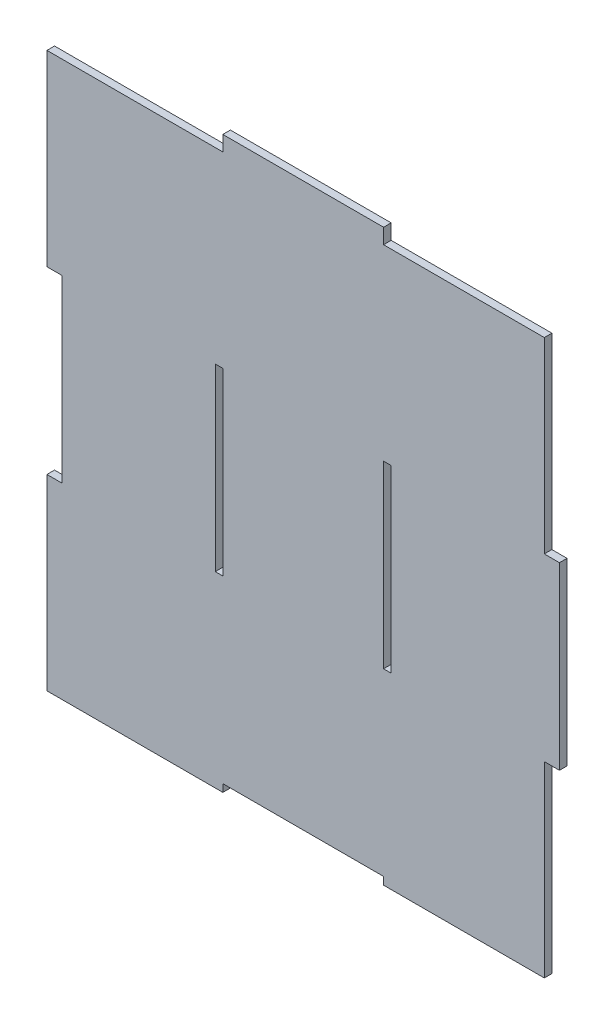
from build123d import *

# Parameters (mm, degrees)
SKETCH2_W           = 3.175
SKETCH2_H           = 75.333333334
BOSS_EXTRUDE1_DEPTH = 3.175
SKETCH3_W           = 3.175
SKETCH3_H           = 78.508333333
SKETCH3_W_2         = 67.333333334
SKETCH3_H_2         = 3.175
BOSS_EXTRUDE2_DEPTH = 3.175
SKETCH4_W           = 3.175
SKETCH4_H           = 78.508333333
CUT_EXTRUDE1_DEPTH  = 3.175


with BuildPart() as part:
    # Sketch2 → Boss-Extrude1 (new body)
    with BuildSketch(Plane.XY):
        Polygon((-113, 37.666666667), (-113, -37.666666667), (-116.175, -37.666666667), (-116.175, -116.175), (-45.666666667, -116.175), (-45.666666667, -113), (21.666666667, -113), (21.666666667, -116.175), (92.175, -116.175), (92.175, -37.666666667), (95.35, -37.666666667), (95.35, 37.666666667), (92.175, 37.666666667), (92.175, 116.175), (21.666666667, 116.175), (21.666666667, 119.35), (-45.666666667, 119.35), (-45.666666667, 116.175), (-116.175, 116.175), (-116.175, 37.666666667), align=None)
        with Locations((-47.254166667, 0)):
            Rectangle(SKETCH2_W, SKETCH2_H, mode=Mode.SUBTRACT)
        with Locations((23.254166667, 0)):
            Rectangle(SKETCH2_W, SKETCH2_H, mode=Mode.SUBTRACT)
    extrude(amount=BOSS_EXTRUDE1_DEPTH)

    # Sketch3 → Boss-Extrude2 (add)
    with BuildSketch(Plane.XY.offset(3.175)):
        with Locations((-117.7625, 76.920833334)):
            Rectangle(SKETCH3_W, SKETCH3_H)
        with Locations((-117.7625, -76.920833334)):
            Rectangle(SKETCH3_W, SKETCH3_H)
        with Locations((-12, 120.9375)):
            Rectangle(SKETCH3_W_2, SKETCH3_H_2)
    extrude(amount=-BOSS_EXTRUDE2_DEPTH)

    # Sketch4 → Cut-Extrude1 (cut)
    with BuildSketch(Plane.XY.offset(3.175)):
        with Locations((90.5875, 76.920833334)):
            Rectangle(SKETCH4_W, SKETCH4_H)
        with Locations((90.5875, -76.920833334)):
            Rectangle(SKETCH4_W, SKETCH4_H)
    extrude(amount=-CUT_EXTRUDE1_DEPTH, mode=Mode.SUBTRACT)


solid = part.part
